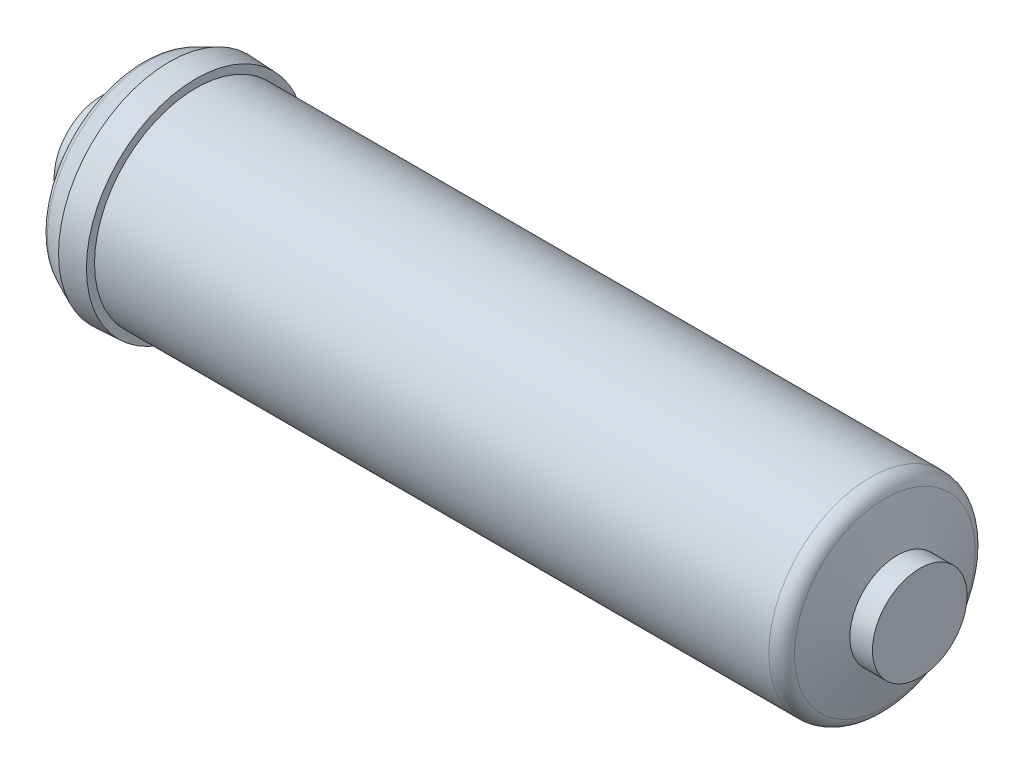
from build123d import *

# Parameters (mm, degrees)
FILLET1_R = 4.7625


with BuildPart() as part:
    # Sketch1 → Revolve1 (revolve)
    with BuildSketch(Plane.XY):
        Polygon((257.175, 0), (257.175, 14.859), (250.063, 14.859), (245.237, 31.877), (29.718, 31.877), (29.718, 34.417), (21.336, 34.798), (12.954, 30.988), (7.9502, 14.859), (0, 14.859), (0, 0), align=None)
    revolve(axis=Axis((0, 0, 0), (1, 0, 0)))

    # Fillet1
    fillet1_edges = [part.edges().sort_by_distance(p)[0] for p in [
        (12.954, -30.988, 0),
        (245.237, -31.877, 0),
    ]]
    fillet(fillet1_edges, radius=FILLET1_R)


solid = part.part
